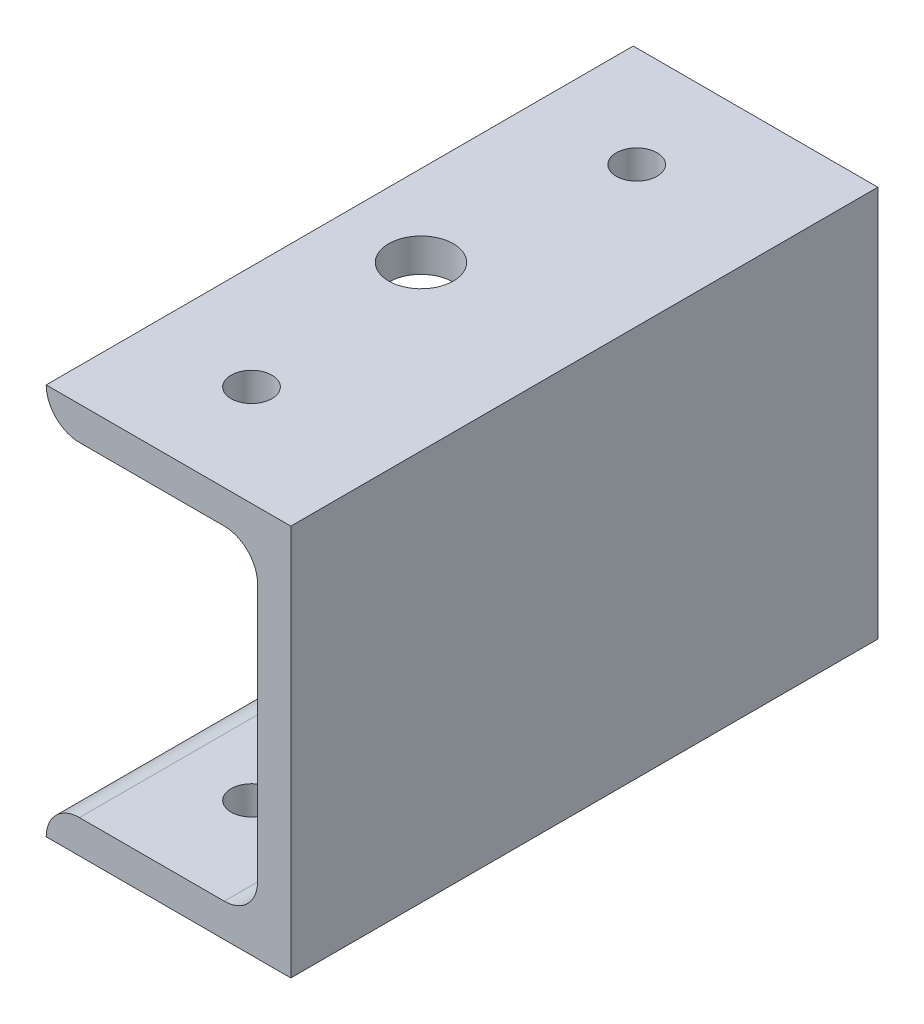
from build123d import *

# Parameters (mm, degrees)
BOSS_EXTRUDE1_DEPTH      = 38.1
FILLET1_START            = -39
FILLET1_DEPTH            = 78
FILLET1_START_2          = -38.1
FILLET1_2_DEPTH          = 76.2
M8_CLEARANCE_HOLE1_D     = 8.4
M8_CLEARANCE_HOLE1_DEPTH = 10.668
M8_CLEARANCE_HOLE1_TIP   = 2.5236146
M5_CLEARANCE_HOLE8_D     = 5.3
M5_CLEARANCE_HOLE8_DEPTH = 4.318
M5_CLEARANCE_HOLE9_D     = 5.3
M5_CLEARANCE_HOLE9_DEPTH = 4.318


with BuildPart() as part:
    # Sketch1 → Boss-Extrude1 (new, symmetric)
    with BuildSketch(Plane.XY):
        Polygon((-101.6, -100.710476364), (-69.85, -100.710476364), (-69.85, -49.910476364), (-101.6, -49.910476364), (-101.6, -54.228476364), (-74.168, -54.228476364), (-74.168, -96.392476364), (-101.6, -96.392476364), align=None)
    extrude(amount=BOSS_EXTRUDE1_DEPTH, both=True)

    # Fillet1: read off the stored shape, not the designer's step
    # Fillet1 outline → Fillet1 (cut)
    with BuildSketch(Plane.XY.offset(FILLET1_START)):
        with BuildLine():
            Line((-101.6, -54.228476364), (-97.282, -54.228476364))
            ThreePointArc((-97.282, -54.228476364), (-100.335287081, -52.963763446), (-101.6, -49.910476364))
            Line((-101.6, -49.910476364), (-101.6, -54.228476364))
        make_face()
        with BuildLine():
            ThreePointArc((-101.6, -100.710476364), (-100.335287081, -97.657189283), (-97.282, -96.392476364))
            Line((-97.282, -96.392476364), (-101.6, -96.392476364))
            Line((-101.6, -96.392476364), (-101.6, -100.710476364))
        make_face()
    extrude(amount=FILLET1_DEPTH, mode=Mode.SUBTRACT)

    # Fillet1 2 outline → Fillet1 2 (add)
    with BuildSketch(Plane.XY.offset(FILLET1_START_2)):
        with BuildLine():
            Line((-74.168, -96.392476364), (-74.168, -92.074476364))
            ThreePointArc((-74.168, -92.074476364), (-75.432712919, -95.127763446), (-78.486, -96.392476364))
            Line((-78.486, -96.392476364), (-74.168, -96.392476364))
        make_face()
        with BuildLine():
            Line((-74.168, -54.228476364), (-78.486, -54.228476364))
            ThreePointArc((-78.486, -54.228476364), (-75.432712919, -55.493189283), (-74.168, -58.546476364))
            Line((-74.168, -58.546476364), (-74.168, -54.228476364))
        make_face()
    extrude(amount=FILLET1_2_DEPTH)

    # M8 Clearance Hole1
    with Locations(Plane(origin=(-6.8, -43.560476364, 0), x_dir=(1, 0, 0), z_dir=(0, 1, 0))):
        with Locations((84.25, 0), (-84.25, 0)):
            Hole(M8_CLEARANCE_HOLE1_D / 2, depth=M8_CLEARANCE_HOLE1_DEPTH)
            with Locations((0, 0, -(M8_CLEARANCE_HOLE1_DEPTH + M8_CLEARANCE_HOLE1_TIP / 2))):  # 118° drill point
                Cone(0, M8_CLEARANCE_HOLE1_D / 2, M8_CLEARANCE_HOLE1_TIP, mode=Mode.SUBTRACT)

    # M5 Clearance Hole8
    with Locations(Plane(origin=(-6.8, -49.910476364, 0), x_dir=(-1, 0, 0), z_dir=(0, 1, 0))):
        with Locations((81.25, 25), (81.25, -25), (-81.25, -25), (-81.25, 25)):
            Hole(M5_CLEARANCE_HOLE8_D / 2, depth=M5_CLEARANCE_HOLE8_DEPTH)

    # M5 Clearance Hole9
    with Locations(Plane(origin=(-6.8, -100.710476364, 0), x_dir=(1, 0, 0), z_dir=(0, -1, 0))):
        with Locations((-81.25, -25), (-81.25, 25), (83.05, 25), (83.05, -25), (-84.25, 0), (84.25, 0)):
            Hole(M5_CLEARANCE_HOLE9_D / 2, depth=M5_CLEARANCE_HOLE9_DEPTH)


solid = part.part
